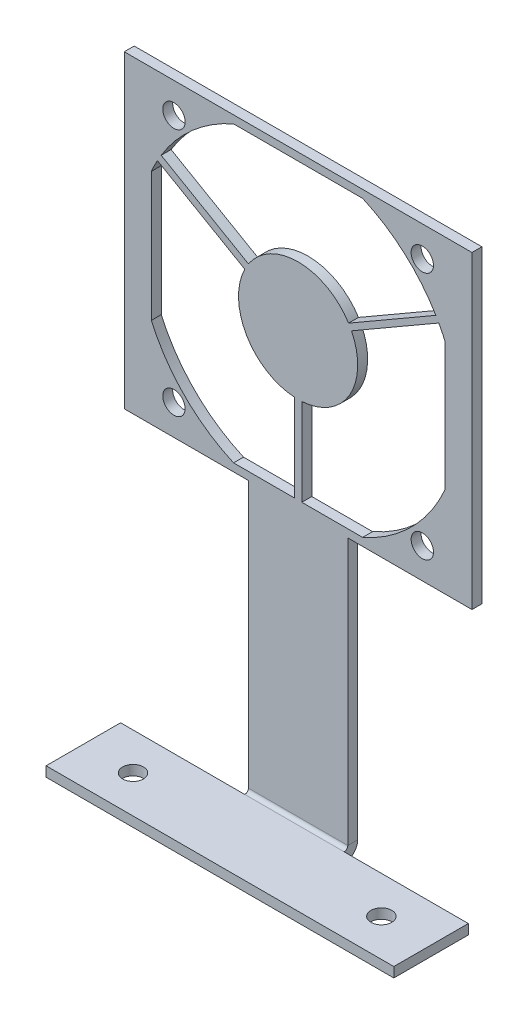
from build123d import *

# Parameters (mm, degrees)
SKETCH1_W               = 70
SKETCH1_H               = 15
BASE_FLANGE1_DEPTH      = 2
EDGE_FLANGE1_DEPTH      = 20
EDGE_FLANGE1_START      = 2
EDGE_FLANGE1_PROFILE_R  = 2.25
EDGE_FLANGE1_FLAT_DEPTH = 2
SKETCH18_R              = 2.1
CUT_EXTRUDE1_DEPTH      = 10


# Sheet-metal steps are written as plain solids
with BuildPart() as part:
    # Sketch1 → Base-Flange1 (new body)
    with BuildSketch(Plane(origin=(0, 0, 0), x_dir=(1, 0, 0), z_dir=(0, 1, 0))):
        Rectangle(SKETCH1_W, SKETCH1_H)
    extrude(amount=-BASE_FLANGE1_DEPTH)

    # Edge-Flange1 bend section (across the edge) → Edge-Flange1 (add)
    with BuildSketch(Plane(origin=(10, 0, -8.2366), x_dir=(0, 0, 1), z_dir=(-1, 0, 0))):
        with BuildLine():
            Line((-2, 0.7366), (0, 0.7366))
            ThreePointArc((0, 0.7366), (0.215745145, 0.215745145), (0.7366, 0))
            Line((0.7366, 0), (0.7366, -2))
            ThreePointArc((0.7366, -2), (-1.198468417, -1.198468417), (-2, 0.7366))
        make_face()
    extrude(amount=EDGE_FLANGE1_DEPTH)

    # Edge-Flange1 profile (on flange) → Edge-Flange1 flat (add)
    with BuildSketch(Plane(origin=(0, 0, -8.2366), x_dir=(-1, 0, 0), z_dir=(0, 0, -1)).offset(EDGE_FLANGE1_START)):
        Polygon((-10, 0.7366), (10, 0.7366), (10, 54.366187709), (35, 54.366187709), (35, 116.622772523), (-35, 116.622772523), (-35, 54.366187709), (-10, 54.366187709), align=None)
        with Locations((25, 60.5)):
            Circle(EDGE_FLANGE1_PROFILE_R, mode=Mode.SUBTRACT)
        with BuildLine():
            Line((29.55, 98.490926284), (29.55, 72.509073716))
            ThreePointArc((29.55, 72.509073716), (22.825059318, 62.674940682), (12.990926284, 55.95))
            Line((12.990926284, 55.95), (0.75, 55.95))
            Line((0.75, 55.95), (0.75, 73.527045436))
            ThreePointArc((0.75, 73.527045436), (10.389206213, 79.501788996), (10.74388281, 90.836958229))
            Line((10.74388281, 90.836958229), (28.322327677, 100.985878105))
            ThreePointArc((28.322327677, 100.985878105), (28.963041516, 99.751627692), (29.55, 98.490926284))
        make_face(mode=Mode.SUBTRACT)
        with Locations((-25, 60.5)):
            Circle(EDGE_FLANGE1_PROFILE_R, mode=Mode.SUBTRACT)
        with BuildLine():
            Line((-0.75, 55.95), (-12.990926284, 55.95))
            ThreePointArc((-12.990926284, 55.95), (-22.825059318, 62.674940682), (-29.55, 72.509073716))
            Line((-29.55, 72.509073716), (-29.55, 98.490926284))
            ThreePointArc((-29.55, 98.490926284), (-28.963041516, 99.751627692), (-28.322327677, 100.985878105))
            Line((-28.322327677, 100.985878105), (-10.74388281, 90.836958229))
            ThreePointArc((-10.74388281, 90.836958229), (-10.389206213, 79.501788996), (-0.75, 73.527045436))
            Line((-0.75, 73.527045436), (-0.75, 55.95))
        make_face(mode=Mode.SUBTRACT)
        with Locations((25, 110.5)):
            Circle(EDGE_FLANGE1_PROFILE_R, mode=Mode.SUBTRACT)
        with BuildLine():
            Line((-10.156894371, 91.883700942), (-27.727157775, 102.027897248))
            ThreePointArc((-27.727157775, 102.027897248), (-21.374853973, 109.688474184), (-12.990926284, 115.05))
            Line((-12.990926284, 115.05), (12.990926284, 115.05))
            ThreePointArc((12.990926284, 115.05), (21.262202003, 109.787557137), (27.572327677, 102.28491621))
            Line((27.572327677, 102.28491621), (9.99388281, 92.135996335))
            ThreePointArc((9.99388281, 92.135996335), (-0.150187994, 97.495481839), (-10.156894371, 91.883700942))
        make_face(mode=Mode.SUBTRACT)
        with Locations((-25, 110.5)):
            Circle(EDGE_FLANGE1_PROFILE_R, mode=Mode.SUBTRACT)
    extrude(amount=-EDGE_FLANGE1_FLAT_DEPTH)

    # Sketch18 → Cut-Extrude1 (cut)
    with BuildSketch(Plane(origin=(0, 0, 0), x_dir=(1, 0, 0), z_dir=(0, 1, 0))):
        with Locations(Location((-25, 0, 0), (0, 0, 270))):
            Circle(SKETCH18_R)
        with Locations(Location((25, 0, 0), (0, 0, 270))):
            Circle(SKETCH18_R)
    extrude(amount=-CUT_EXTRUDE1_DEPTH, mode=Mode.SUBTRACT)


solid = part.part
